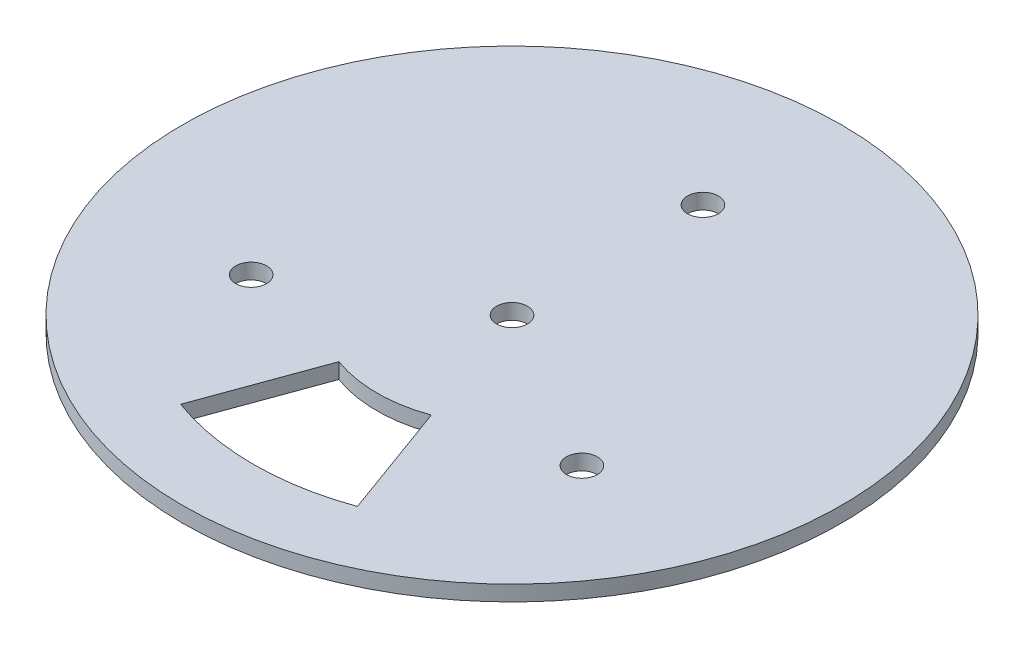
from build123d import *

# Parameters (mm, degrees)
ESBO_O1_R                = 85.4
RESSALTO_EXTRUS_O1_DEPTH = 4
CORTE_EXTRUS_O2_DEPTH    = 121.840059583
ESBO_O4_R                = 4
CORTE_EXTRUS_O3_DEPTH    = 121.840059583
ESBO_O5_R                = 4
CORTE_EXTRUS_O4_DEPTH    = 121.840059583


with BuildPart() as part:
    # Esboço1 → Ressalto-extrusão1 (new body)
    with BuildSketch(Plane(origin=(0, 0, 0), x_dir=(1, 0, 0), z_dir=(0, 1, 0))):
        Circle(ESBO_O1_R)
    extrude(amount=RESSALTO_EXTRUS_O1_DEPTH)

    # Esboço3 → Corte-extrusão2 (cut, through all)
    with BuildSketch(Plane.XZ):
        with BuildLine():
            Line((11.970705016, 32.889241728), (22.915349603, 62.959405593))
            ThreePointArc((22.915349603, 62.959405593), (0, 67), (-22.915349603, 62.959405593))
            Line((-22.915349603, 62.959405593), (-11.970705016, 32.889241728))
            ThreePointArc((-11.970705016, 32.889241728), (0, 35), (11.970705016, 32.889241728))
        make_face()
    extrude(amount=-CORTE_EXTRUS_O2_DEPTH, mode=Mode.SUBTRACT)

    # Esboço4 → Corte-extrusão3 (cut, through all)
    with BuildSketch(Plane(origin=(0, 4, 0), x_dir=(1, 0, 0), z_dir=(0, 1, 0))):
        with Locations((42.850936979, -24.74)):
            Circle(ESBO_O4_R)
        with Locations((0, 49.48)):
            Circle(ESBO_O4_R)
        with Locations((-42.850936979, -24.74)):
            Circle(ESBO_O4_R)
    extrude(amount=-CORTE_EXTRUS_O3_DEPTH, mode=Mode.SUBTRACT)

    # Esboço5 → Corte-extrusão4 (cut, through all)
    with BuildSketch(Plane.XZ):
        Circle(ESBO_O5_R)
    extrude(amount=-CORTE_EXTRUS_O4_DEPTH, mode=Mode.SUBTRACT)


solid = part.part
